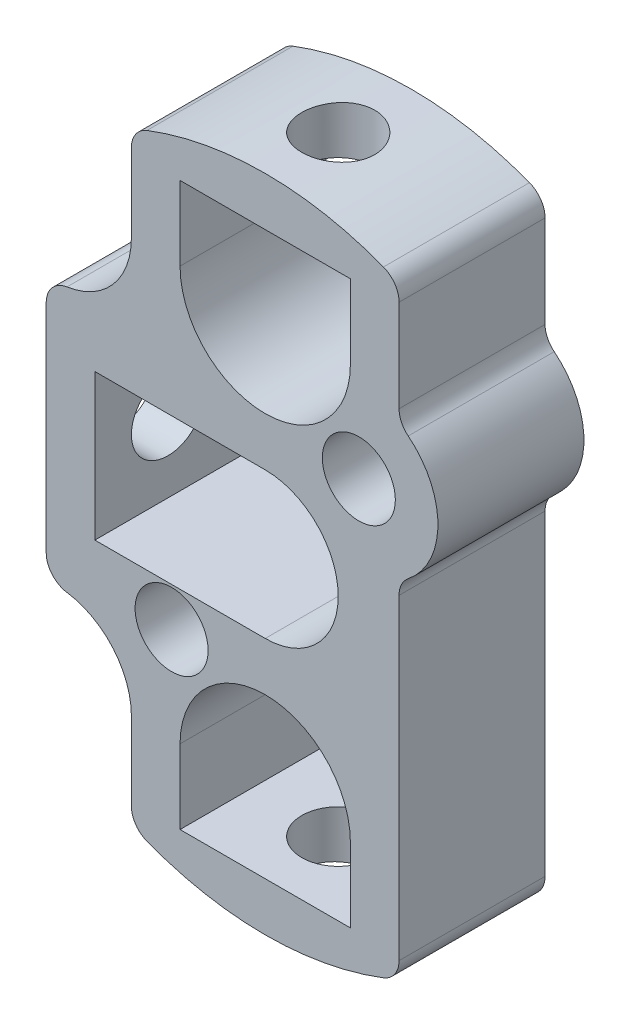
from build123d import *

# Parameters (mm, degrees)
ESQUISSE1_R             = 1.5
BOSS_EXTRU_1_DEPTH      = 6
ESQUISSE2_R             = 1.5
ENL_V_MAT_EXTRU_1_DEPTH = 28.331483677
ESQUISSE3_R             = 1.5
ENL_V_MAT_EXTRU_2_DEPTH = 21.452849624


with BuildPart() as part:
    # Esquisse1 → Boss.-Extru.1 (new body)
    with BuildSketch(Plane.XY):
        with BuildLine():
            ThreePointArc((-8.145422919, 5.437314339), (-8.756777021, 5.101617869), (-9, 4.447944754))
            Line((-9, 4.447944754), (-9, -4.447944754))
            ThreePointArc((-9, -4.447944754), (-8.756777021, -5.101617869), (-8.145422919, -5.437314339))
            ThreePointArc((-8.145422919, -5.437314339), (-6.252919377, -6.476494015), (-5.5, -8.5))
            Line((-5.5, -8.5), (-5.5, -11.715481211))
            ThreePointArc((-5.5, -11.715481211), (-5.324186186, -12.281800142), (-4.858565737, -12.64898569))
            ThreePointArc((-4.858565737, -12.64898569), (0, -13.55), (4.858565737, -12.64898569))
            ThreePointArc((4.858565737, -12.64898569), (5.324186186, -12.281800142), (5.5, -11.715481211))
            Line((5.5, -11.715481211), (5.5, 1.284668728))
            ThreePointArc((5.5, 1.284668728), (5.598803794, 1.718080078), (5.875690797, 2.065846057))
            ThreePointArc((5.875690797, 2.065846057), (7.096685887, 4.604672376), (5.875690797, 7.143498694))
            ThreePointArc((5.875690797, 7.143498694), (5.598803794, 7.491264673), (5.5, 7.924676023))
            Line((5.5, 7.924676023), (5.5, 11.715481211))
            ThreePointArc((5.5, 11.715481211), (5.324186186, 12.281800142), (4.858565737, 12.64898569))
            ThreePointArc((4.858565737, 12.64898569), (0, 13.55), (-4.858565737, 12.64898569))
            ThreePointArc((-4.858565737, 12.64898569), (-5.324186186, 12.281800142), (-5.5, 11.715481211))
            Line((-5.5, 11.715481211), (-5.5, 8.5))
            ThreePointArc((-5.5, 8.5), (-6.252919377, 6.476494015), (-8.145422919, 5.437314339))
        make_face()
        with Locations((-3.846685887, -4.604672376)):
            Circle(ESQUISSE1_R, mode=Mode.SUBTRACT)
        with BuildLine():
            ThreePointArc((0, 3), (3, 0), (0, -3))
            Line((0, -3), (-7, -3))
            Line((-7, -3), (-7, 3))
            Line((-7, 3), (0, 3))
        make_face(mode=Mode.SUBTRACT)
        with BuildLine():
            Line((3.5, -11.55), (-3.5, -11.55))
            Line((-3.5, -11.55), (-3.5, -8.5))
            ThreePointArc((-3.5, -8.5), (0, -5), (3.5, -8.5))
            Line((3.5, -8.5), (3.5, -11.55))
        make_face(mode=Mode.SUBTRACT)
        with Locations((3.846685887, 4.604672376)):
            Circle(ESQUISSE1_R, mode=Mode.SUBTRACT)
        with BuildLine():
            Line((-3.5, 8.5), (-3.5, 11.55))
            Line((-3.5, 11.55), (3.5, 11.55))
            Line((3.5, 11.55), (3.5, 8.5))
            ThreePointArc((3.5, 8.5), (0, 5), (-3.5, 8.5))
        make_face(mode=Mode.SUBTRACT)
    extrude(amount=BOSS_EXTRU_1_DEPTH)

    # Esquisse2 → Enlèv. mat.-Extru.1 (cut, through all)
    with BuildSketch(Plane.XZ.offset(-11.55)):
        with Locations((0, 3)):
            Circle(ESQUISSE2_R)
    enl_v_mat_extru_1 = extrude(amount=-ENL_V_MAT_EXTRU_1_DEPTH, mode=Mode.SUBTRACT)

    # Symétrie1: Enlèv. mat.-Extru.1 across plane
    add(enl_v_mat_extru_1.mirror(Plane.ZX), mode=Mode.SUBTRACT)

    # Esquisse3 → Enlèv. mat.-Extru.2 (cut, through all)
    with BuildSketch(Plane(origin=(-7, 0, 0), x_dir=(0, 0, -1), z_dir=(1, 0, 0))):
        with Locations((-3, 0)):
            Circle(ESQUISSE3_R)
    extrude(amount=-ENL_V_MAT_EXTRU_2_DEPTH, mode=Mode.SUBTRACT)


solid = part.part
